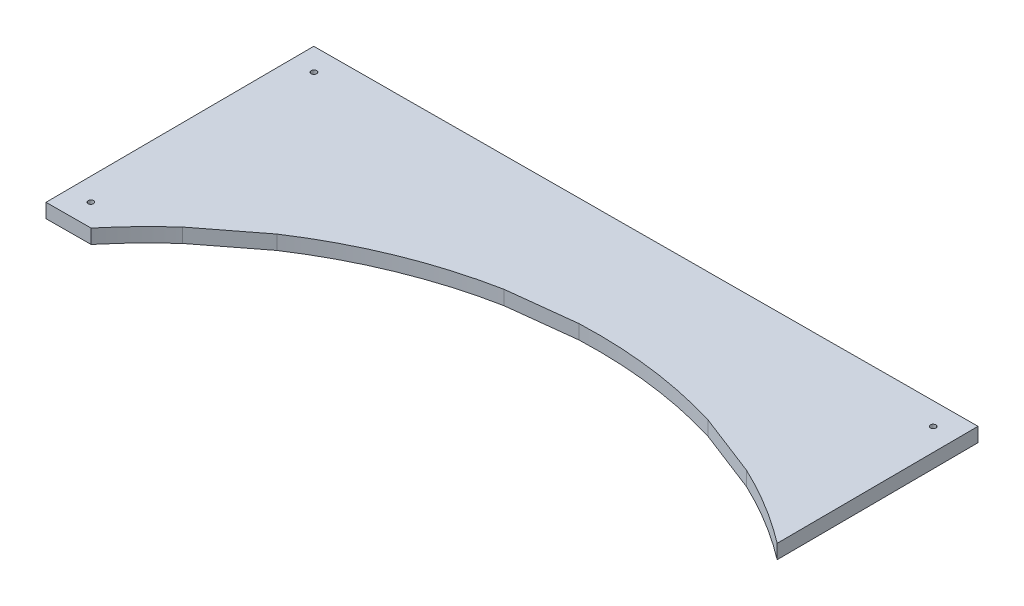
from build123d import *

# Parameters (mm, degrees)
SKETCH1_R           = 1.225
BOSS_EXTRUDE1_DEPTH = 6.35


with BuildPart() as part:
    # Sketch1 → Boss-Extrude1 (new body)
    with BuildSketch(Plane(origin=(0, 0, 0), x_dir=(1, 0, 0), z_dir=(0, 1, 0))):
        with BuildLine():
            Line((19.999792019, 0.091209594), (0, 0))
            Line((0, 0), (-0.547257564, 119.998752115))
            Line((-0.547257564, 119.998752115), (294.449674718, 121.344093627))
            Line((294.449674718, 121.344093627), (294.86012216, 31.344093627))
            ThreePointArc((294.86012216, 31.344093627), (277.870515385, 42.942471612), (259.779400189, 52.734338707))
            Line((259.779400189, 52.734338707), (231.756657954, 63.5857763))
            ThreePointArc((231.756657954, 63.5857763), (199.118358441, 70.566953886), (165.773569429, 72.023141123))
            Line((165.773569429, 72.023141123), (135.773569429, 68.543550593))
            ThreePointArc((135.773569429, 68.543550593), (98.326093616, 57.414966094), (63.756361786, 39.21901932))
            Line((63.756361786, 39.21901932), (40.005697256, 20.884351348))
            ThreePointArc((40.005697256, 20.884351348), (29.627268731, 10.849040712), (19.999792019, 0.091209594))
        make_face()
        with Locations((9.498243242, 110.044460902)):
            Circle(SKETCH1_R, mode=Mode.SUBTRACT)
        with Locations((9.954291213, 10.045500807)):
            Circle(SKETCH1_R, mode=Mode.SUBTRACT)
        with Locations((284.495383506, 111.298592821)):
            Circle(SKETCH1_R, mode=Mode.SUBTRACT)
    extrude(amount=BOSS_EXTRUDE1_DEPTH)


solid = part.part
